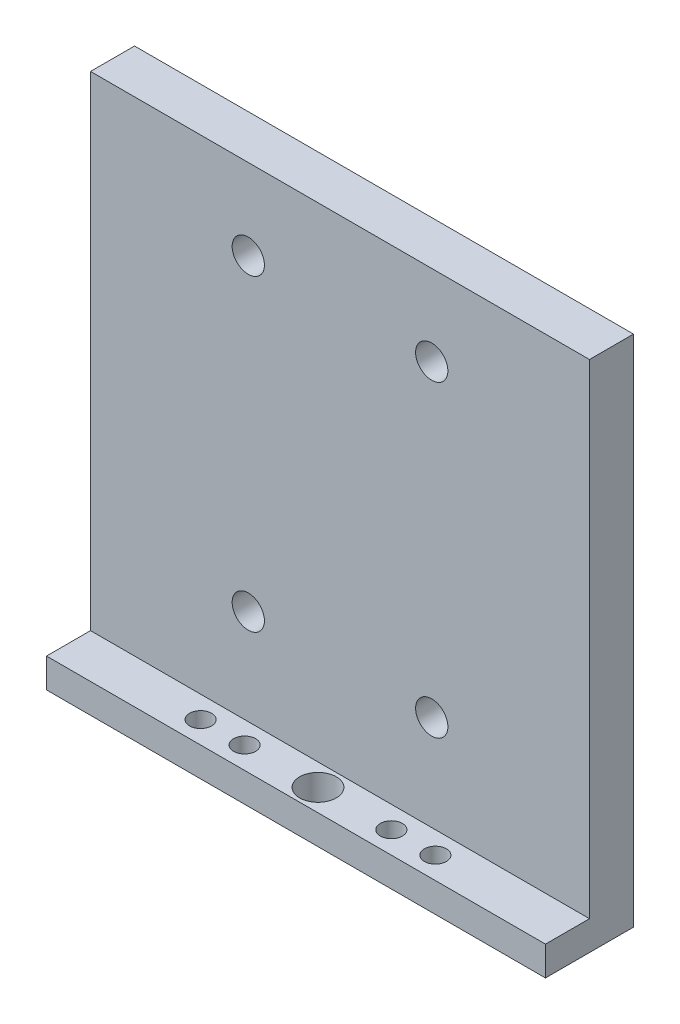
from build123d import *

# Parameters (mm, degrees)
BOSS_EXTRUDE1_DEPTH = 34
SKETCH2_R           = 1.1
CUT_EXTRUDE1_DEPTH  = 49.887626246
SKETCH3_R           = 1.25
SKETCH3_R_2         = 0.75
CUT_EXTRUDE2_DEPTH  = 48.759815745


with BuildPart() as part:
    # Sketch1 → Boss-Extrude1 (new body)
    with BuildSketch(Plane(origin=(0, 0, 0), x_dir=(0, 0, -1), z_dir=(1, 0, 0))):
        Polygon((0, 0), (6, 0), (6, 35), (3, 35), (3, 2), (0, 2), align=None)
    extrude(amount=BOSS_EXTRUDE1_DEPTH)

    # Sketch2 → Cut-Extrude1 (cut, through all)
    with BuildSketch(Plane.XY.offset(-3)):
        with Locations((23.25, 29.5)):
            Circle(SKETCH2_R)
        with Locations((10.75, 29.5)):
            Circle(SKETCH2_R)
        with Locations((10.75, 8.5)):
            Circle(SKETCH2_R)
        with Locations((23.25, 8.5)):
            Circle(SKETCH2_R)
    extrude(amount=-CUT_EXTRUDE1_DEPTH, mode=Mode.SUBTRACT)

    # Sketch3 → Cut-Extrude2 (cut, through all)
    with BuildSketch(Plane(origin=(0, 2, 0), x_dir=(1, 0, 0), z_dir=(0, 1, 0))):
        with Locations((17, 1.5)):
            Circle(SKETCH3_R)
        with Locations((22, 1.5)):
            Circle(SKETCH3_R_2)
        with Locations((25, 1.5)):
            Circle(SKETCH3_R_2)
        with Locations((12, 1.5)):
            Circle(SKETCH3_R_2)
        with Locations((9, 1.5)):
            Circle(SKETCH3_R_2)
    extrude(amount=-CUT_EXTRUDE2_DEPTH, mode=Mode.SUBTRACT)


solid = part.part
